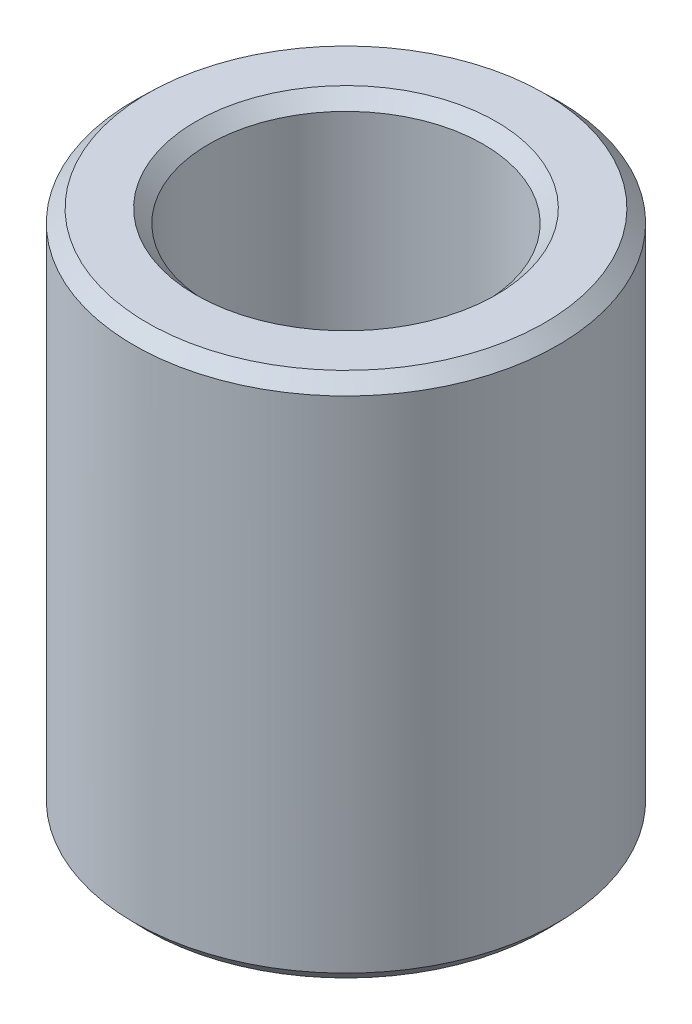
from build123d import *
from OCP.BRepFilletAPI import BRepFilletAPI_MakeChamfer

# Parameters (mm, degrees)
SKETCH1_R           = 22.5
BOSS_EXTRUDE1_DEPTH = 55.844355692
SKETCH2_R           = 14.581818275
CUT_EXTRUDE1_DEPTH  = 65.273572039
CHAMFER1_SIZE       = 1.364121003
CHAMFER1_SIZE2      = 1.406857088


with BuildPart() as part:
    # Sketch1 → Boss-Extrude1 (new body)
    with BuildSketch(Plane(origin=(0, 0, 0), x_dir=(1, 0, 0), z_dir=(0, 1, 0))):
        Circle(SKETCH1_R)
    extrude(amount=BOSS_EXTRUDE1_DEPTH)

    # Sketch2 → Cut-Extrude1 (cut, through all)
    with BuildSketch(Plane(origin=(0, 0, 0), x_dir=(1, 0, 0), z_dir=(0, 1, 0))):
        Circle(SKETCH2_R)
    extrude(amount=CUT_EXTRUDE1_DEPTH, mode=Mode.SUBTRACT)

    # Chamfer1: one chamfer whose edges measure the first distance from different faces: ONE call of the kernel's chamfer builder (chamfer() names one face for all edges)
    chamfer1_edges_1 = [part.edges().sort_by_distance(p)[0] for p in [
        (-14.581818275, 55.844355692, 0),
    ]]
    chamfer1_side_1 = [part.faces().sort_by_distance(p)[0] for p in [
        (-21.863603897, 55.844355692, 0),
    ]]
    chamfer1_edges_2 = [part.edges().sort_by_distance(p)[0] for p in [
        (-14.581818275, 0, 0),
    ]]
    chamfer1_side_2 = [part.faces().sort_by_distance(p)[0] for p in [
        (-14.581818275, 27.922177846, 0),
    ]]
    chamfer1_edges_3 = [part.edges().sort_by_distance(p)[0] for p in [
        (-22.5, 0, 0),
    ]]
    chamfer1_side_3 = [part.faces().sort_by_distance(p)[0] for p in [
        (-21.863603897, 0, 0),
    ]]
    chamfer1_edges_4 = [part.edges().sort_by_distance(p)[0] for p in [
        (-22.5, 55.844355692, 0),
    ]]
    chamfer1_side_4 = [part.faces().sort_by_distance(p)[0] for p in [
        (-22.5, 27.922177846, 0),
    ]]
    chamfer1 = BRepFilletAPI_MakeChamfer(part.part.solid().wrapped)
    for e in chamfer1_edges_1:
        chamfer1.Add(CHAMFER1_SIZE, CHAMFER1_SIZE2, e.wrapped, chamfer1_side_1[0].wrapped)  # the first distance lies on this face
    for e in chamfer1_edges_2:
        chamfer1.Add(CHAMFER1_SIZE, CHAMFER1_SIZE2, e.wrapped, chamfer1_side_2[0].wrapped)  # the first distance lies on this face
    for e in chamfer1_edges_3:
        chamfer1.Add(CHAMFER1_SIZE, CHAMFER1_SIZE2, e.wrapped, chamfer1_side_3[0].wrapped)  # the first distance lies on this face
    for e in chamfer1_edges_4:
        chamfer1.Add(CHAMFER1_SIZE, CHAMFER1_SIZE2, e.wrapped, chamfer1_side_4[0].wrapped)  # the first distance lies on this face
    add(Compound.cast(chamfer1.Shape()), mode=Mode.REPLACE)


solid = part.part
